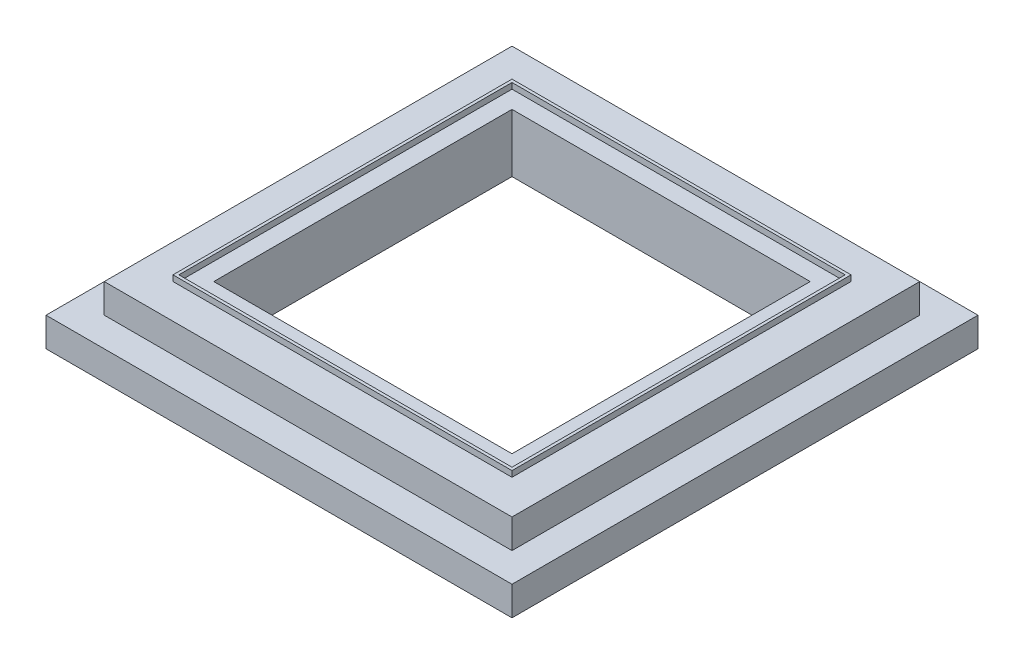
from build123d import *

# Parameters (mm, degrees)
SKETCH_4_W          = 51.2
SKETCH_4_H          = 51.2
CUT_EXTRUDE_1_DEPTH = 58.445626622
SKETCH_5_W          = 58.2
SKETCH_5_H          = 58.2
SKETCH_5_W_2        = 57.2
SKETCH_5_H_2        = 57.2
EXTRUDE_1_DEPTH     = 1


with BuildPart() as part:
    # Эскиз1 → По сечениям1 section 0
    with BuildSketch(Plane(origin=(0, 0, 0), x_dir=(1, 0, 0), z_dir=(0, 1, 0))):
        with BuildLine():
            Line((-40, -40), (40, -40))
            Line((40, -40), (40, 40))
            Line((40, 40), (-40, 40))
            Line((-40, 40), (-40, -40))
        make_face()
    # Эскиз2 → По сечениям1 section 1
    with BuildSketch(Plane(origin=(0, 5, 0), x_dir=(1, 0, 0), z_dir=(0, 1, 0))):
        with BuildLine():
            Line((-40, -40), (40, -40))
            Line((40, -40), (40, 40))
            Line((40, 40), (-40, 40))
            Line((-40, 40), (-40, -40))
        make_face()
    loft()

    # Эскиз2<3> → По сечениям2 section 0
    with BuildSketch(Plane(origin=(0, 5, 0), x_dir=(1, 0, 0), z_dir=(0, 1, 0))):
        with BuildLine():
            Line((-35, -35), (35, -35))
            Line((35, -35), (35, 35))
            Line((35, 35), (-35, 35))
            Line((-35, 35), (-35, -35))
        make_face()
    # Эскиз3 → По сечениям2 section 1
    with BuildSketch(Plane(origin=(0, 10, 0), x_dir=(1, 0, 0), z_dir=(0, 1, 0))):
        with BuildLine():
            Line((-35, -35), (35, -35))
            Line((35, -35), (35, 35))
            Line((35, 35), (-35, 35))
            Line((-35, 35), (-35, -35))
        make_face()
    loft()

    # Эскиз4 → Вырез-Вытянуть1 (cut, through all)
    with BuildSketch(Plane(origin=(0, 10, 0), x_dir=(1, 0, 0), z_dir=(0, 1, 0))):
        Rectangle(SKETCH_4_W, SKETCH_4_H)
    extrude(amount=-CUT_EXTRUDE_1_DEPTH, mode=Mode.SUBTRACT)

    # Эскиз5 → Бобышка-Вытянуть1 (add)
    with BuildSketch(Plane(origin=(0, 10, 0), x_dir=(1, 0, 0), z_dir=(0, 1, 0))):
        Rectangle(SKETCH_5_W, SKETCH_5_H)
        Rectangle(SKETCH_5_W_2, SKETCH_5_H_2, mode=Mode.SUBTRACT)
    extrude(amount=EXTRUDE_1_DEPTH)


solid = part.part
